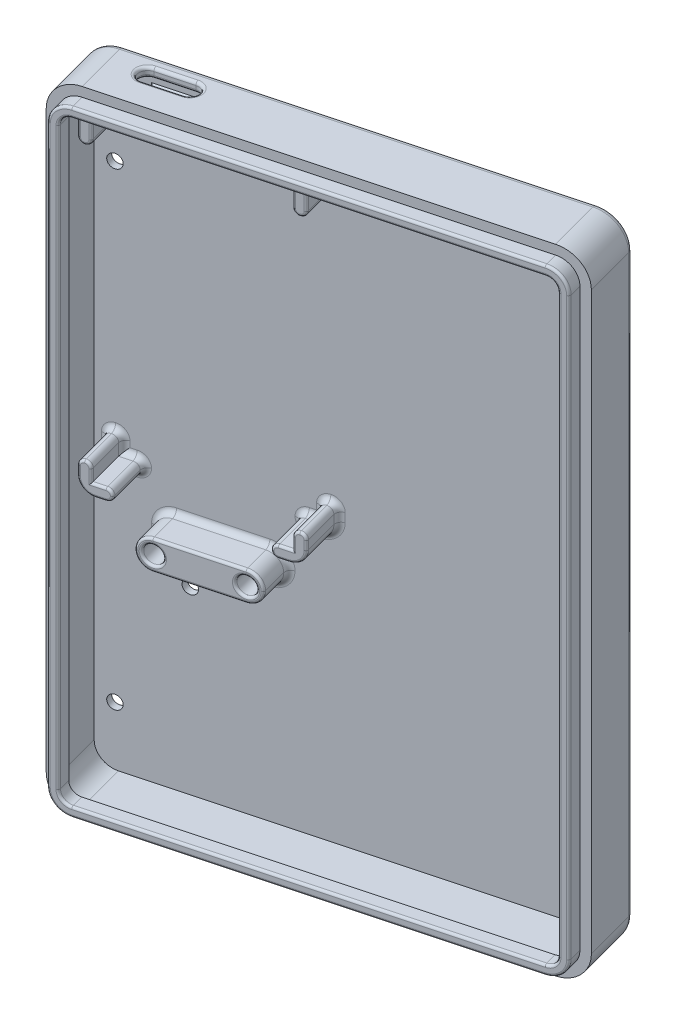
from build123d import *

# Parameters (mm, degrees)
BOSS_EXTRUDE1_DEPTH      = 10
FILLET1_R                = 5
FILLET2_R                = 1
SHELL1_T                 = -1.6
SHELL1_THICKNESS_2_DEPTH = 0.4
SKETCH2_W                = 2
SKETCH2_H                = 5.000000000000007
BOSS_EXTRUDE2_DEPTH      = 7.5
SKETCH2_3_W              = 18.000000000000128
SKETCH2_3_H              = 5
SKETCH2_3_R              = 1.4999999999999967
BOSS_EXTRUDE3_DEPTH      = 5.75
FILLET3_R                = 2.5
FILLET4_R                = 1
FILLET5_R                = 0.4
BOSS_EXTRUDE4_DEPTH      = 1
CUT_EXTRUDE1_DEPTH       = 135.00829340306532
FILLET6_R                = 0.5
BOSS_EXTRUDE5_DEPTH      = 2.5
BOSS_EXTRUDE5_DEPTH_BACK = 1.5
BOSS_EXTRUDE5_START      = 8.8
SHELL2_T                 = -1.6
FILLET8_R                = 0.4
CHAMFER1_SIZE            = 1.6
FILLET9_R                = 0.5
SKETCH6_R                = 1.1500000000000026
SKETCH6_R_2              = 1.149999999999996
SKETCH6_R_3              = 1.1499999999999893
CUT_EXTRUDE2_DEPTH       = 97.07169882733713
BOSS_EXTRUDE6_START      = -5.75
SKETCH7_W                = 20.00000000000005
SKETCH7_H                = 5
BOSS_EXTRUDE6_DEPTH      = 0.75
CHAMFER2_SIZE            = 0.75


# Some blends are built 0.0001 mm under size
with BuildPart() as part:
    # Sketch1 → Boss-Extrude1 (new body)
    with BuildSketch(Plane(origin=(-3.669259578336618, 0, -13.693863172510985), x_dir=(0.9659258262890682, 0, -0.2588190451025213), z_dir=(-0.2588190451025213, 0, -0.9659258262890682))):
        Polygon((-74.20000000000003, 51.599999999999994), (1.799999999999982, 51.599999999999994), (1.799999999999996, -56.6), (-74.20000000000002, -56.6), align=None)
    extrude(amount=BOSS_EXTRUDE1_DEPTH)

    # Fillet1
    fillet1_edges = [part.edges().sort_by_distance(p)[0] for p in [
        (-76.63505111449813, -51.599999999999994, 0.6808808426507635),
        (-3.224688316528919, -51.599999999999994, -18.989366585140857),
        (-3.2246883165289053, 56.6, -18.989366585140864),
        (-76.63505111449811, 56.6, 0.68088084265076),
    ]]
    fillet(fillet1_edges, radius=FILLET1_R)

    # Fillet2
    fillet2_edges = [part.edges().sort_by_distance(p)[0] for p in [
        (-41.22396494102611, -51.599999999999994, -13.983872002690394),
        (-4.518783542041518, 2.500000000000007, -23.818995716586205),
        (-77.92914634001073, 2.499999999999993, -4.148748288794579),
        (-41.22396494102611, 56.6, -13.983872002690394),
        (-76.51458071802648, -50.135533905932746, -4.527780004846088),
        (-76.51458071802648, 55.13553390593274, -4.527780004846088),
        (-5.933349164025755, 55.135533905932746, -23.439964000534697),
        (-5.933349164025763, -50.13553390593273, -23.439964000534694),
    ]]
    fillet(fillet2_edges, radius=FILLET2_R)

    # Shell1
    shell1_openings = [part.faces().sort_by_distance(p)[0] for p in [
        (-38.63577449, 2.5, -4.32461374),
    ]]
    offset(amount=SHELL1_T, openings=shell1_openings, kind=Kind.INTERSECTION)

    # Shell1 thickness 2 face (on inner face of the shell) → Shell1 thickness 2 (cut)
    with BuildSketch(Plane(origin=(-40.809854469, 2.5, -12.438390681), x_dir=(-0.965925826289, 0, 0.258819045103), z_dir=(-0.258819045103, 0, -0.965925826289))):
        with BuildLine():
            Line((32.99999999996312, -52.5), (-33.00000000003692, -52.5))
            ThreePointArc((-33.00000000003692, -52.49999999999999), (-35.404163056071184, -51.50416305603426), (-36.40000000003692, -49.099999999999994))
            Line((-36.400000000036925, -49.099999999999994), (-36.40000000003694, 49.10000000000001))
            ThreePointArc((-36.40000000003693, 49.10000000000001), (-35.40416305607119, 51.50416305603427), (-33.00000000003693, 52.50000000000001))
            Line((-33.000000000036934, 52.50000000000001), (32.99999999996312, 52.50000000000001))
            ThreePointArc((32.999999999963094, 52.5), (35.40416305599737, 51.504163056034265), (36.3999999999631, 49.1))
            Line((36.3999999999631, 49.1), (36.399999999963114, -49.100000000000016))
            ThreePointArc((36.3999999999631, -49.10000000000001), (35.40416305599736, -51.50416305603427), (32.999999999963094, -52.50000000000001))
        make_face()
    extrude(amount=SHELL1_THICKNESS_2_DEPTH, mode=Mode.SUBTRACT)

    # Sketch2 → Boss-Extrude2 (add)
    with BuildSketch(Plane(origin=(-5.946867175238807, 5e-17, -22.19401044385479), x_dir=(0.9659258262890682, 0, -0.2588190451025213), z_dir=(0.2588190451025213, 0, 0.9659258262890682))):
        Polygon((-70.59999999999977, -4.650000000000041), (-70.59999999999977, 0.349999999999958), (-68.59999999999977, 0.349999999999958), (-68.59999999999977, -2.650000000000041), (-65.59999999999977, -2.650000000000041), (-65.59999999999977, -4.650000000000041), align=None)
        Polygon((-40.599999999999746, 0.34999999999995884), (-38.599999999999746, 0.34999999999995884), (-38.599999999999746, -4.650000000000041), (-43.59999999999975, -4.650000000000041), (-43.59999999999975, -2.650000000000041), (-40.599999999999746, -2.650000000000041), align=None)
        with Locations((-69.59999999999977, 49.5)):
            Rectangle(SKETCH2_W, SKETCH2_H)
        with Locations((-39.599999999999746, 49.5)):
            Rectangle(SKETCH2_W, SKETCH2_H)
    extrude(amount=BOSS_EXTRUDE2_DEPTH)

    # Sketch2<3> → Boss-Extrude3 (add)
    with BuildSketch(Plane(origin=(-5.946867175238807, 5e-17, -22.19401044385479), x_dir=(0.9659258262890682, 0, -0.2588190451025213), z_dir=(0.2588190451025213, 0, 0.9659258262890682))):
        with Locations((-54.5999999999997, -11.74999999999998)):
            Rectangle(SKETCH2_3_W, SKETCH2_3_H)
        with Locations((-48.099999999999646, -11.74999999999998)):
            Circle(SKETCH2_3_R, mode=Mode.SUBTRACT)
        with Locations((-61.09999999999977, -11.749999999999979)):
            Circle(SKETCH2_3_R, mode=Mode.SUBTRACT)
    extrude(amount=BOSS_EXTRUDE3_DEPTH)

    # Fillet3
    fillet3_edges = [part.edges().sort_by_distance(p)[0] for p in [
        (-49.24898009935022, -14.24999999999998, -7.614825236598841),
        (-49.24898009935022, -9.24999999999998, -7.614825236598841),
        (-66.63564497255356, -9.24999999999998, -2.9560824247534265),
        (-66.63564497255356, -14.24999999999998, -2.9560824247534265),
        (-73.17065909211234, -4.650000000000041, -0.29916401103284196),
        (-42.261032650862134, -4.650000000000041, -8.581373454313528),
    ]]
    fillet(fillet3_edges, radius=FILLET3_R - 0.0001)  # a hair under: the kernel refuses the full size

    # Fillet4
    fillet4_edges = [part.edges().sort_by_distance(p)[0] for p in [
        (-44.19288430344027, 0.3499999999999589, -8.063735364108485),
        (-46.61234446200834, -2.650000000000041, -11.297728645038708),
        (-48.061233201441944, -3.650000000000041, -10.909500077384925),
        (-47.090661782307485, -2.650000000000041, -7.287278228800918),
        (-47.090661782307485, -4.650000000000041, -7.287278228800918),
        (-44.197529896285666, 0.3499999999999589, -11.944776257795013),
        (-73.17530468495772, 52.00000000000001, -4.180204904719368),
        (-71.2388074395342, 52.00000000000001, -0.8168021012378848),
        (-73.17065909211234, 52.00000000000001, -0.2991640110328415),
        (-73.17065909211234, 47.00000000000001, -0.2991640110328415),
        (-72.20937885866866, 49.50000000000001, -4.439023949821891),
        (-71.2388074395342, 47.00000000000001, -0.8168021012378848),
        (-73.17530468495772, 47.00000000000001, -4.180204904719368),
        (-74.1412305112468, 49.50000000000001, -3.921385859616848),
        (-44.197529896285666, 47.00000000000001, -11.944776257795013),
        (-44.19288430344027, 47.00000000000001, -8.063735364108485),
        (-42.261032650862134, 47.00000000000001, -8.581373454313528),
        (-42.261032650862134, 52.00000000000001, -8.581373454313528),
        (-45.16345572257473, 49.50000000000001, -11.685957212692491),
        (-44.19288430344027, 52.00000000000001, -8.063735364108485),
        (-44.197529896285666, 52.00000000000001, -11.944776257795013),
        (-43.23160406999659, 49.50000000000001, -12.203595302897535),
        (-73.17065909211234, 0.349999999999958, -0.2991640110328415),
        (-68.341029960667, -4.650000000000041, -1.5932592365454479),
        (-68.341029960667, -2.650000000000041, -1.5932592365454479),
        (-73.17530468495772, 0.349999999999958, -4.180204904719368),
        (-71.2388074395342, 0.349999999999958, -0.8168021012378848),
        (-72.20937885866866, -1.1500000000000417, -4.439023949821891),
        (-70.76049011923506, -2.650000000000041, -4.827252517475671),
        (-69.31160137980146, -3.650000000000041, -5.215481085129454),
        (-70.51905695895411, -4.650000000000041, -4.891944337799046),
        (-74.1412305112468, -0.900050000000042, -3.921385859616848),
        (-43.23160406999659, -0.9000500000000415, -12.203595302897535),
        (-46.85377762228929, -4.650000000000041, -11.233036824715333),
        (-58.68641729062165, -14.24999999999998, -8.062490581257203),
        (-58.686417290621634, -9.24999999999998, -8.062490581257208),
        (-73.43397599166543, -3.9177962422882926, -4.110894137375142),
        (-43.93885858977793, -3.917796242288289, -12.014087025885495),
        (-50.700339373800446, -13.517796242288233, -10.202353710164621),
        (-50.70033937380044, -9.982203757711732, -10.202353710164623),
        (-66.6724952076428, -9.982203757711723, -5.92262745309605),
        (-66.67249520764283, -13.517796242288231, -5.9226274530960445),
        (-42.261032650862134, 0.3499999999999589, -8.581373454313528),
        (-45.16345572257473, -1.1500000000000412, -11.685957212692491),
    ]]
    fillet(fillet4_edges, radius=FILLET4_R - 0.0001)  # a hair under: the kernel refuses the full size

    # Fillet5
    fillet5_edges = [part.edges().sort_by_distance(p)[0] for p in [
        (-44.188287006886206, -2.650000000000041, -4.182681529469702),
        (-69.30226189781938, -2.650000000000041, 2.546587761291349),
        (-64.92561439159476, -11.749999999999979, -0.43786471927487725),
        (-52.36857864983675, -11.74999999999998, -3.802512305607685),
        (-69.06082873753843, -4.650000000000041, 2.481895940967977),
        (-72.20008767297789, -1.4000000000000417, 3.323057837551165),
        (-71.49283315329822, -3.9177962422882926, 3.1335495601597363),
        (-41.29046123172768, -1.4000000000000414, -4.959151605729522),
        (-44.42972016716716, -4.650000000000041, -4.117989709146325),
        (-41.99771575140737, -3.917796242288295, -4.769643328338092),
        (-57.19820778128215, -14.24999999999998, -2.5084170800950627),
        (-57.19820778128214, -9.24999999999998, -2.5084170800950663),
        (-65.18428569820415, -13.517796242288233, -0.36855395156378584),
        (-65.18428569820414, -9.982203757711728, -0.36855395156378945),
        (-49.21212986436016, -9.982203757711728, -4.648280208626337),
        (-49.21212986436016, -13.517796242288233, -4.648280208626337),
        (-43.22231288430582, -1.6499500000000409, -4.441513515524479),
        (-70.26823602039974, -1.6499500000000413, 2.8054197473461215),
        (-43.22231288430582, 49.50000000000001, -4.441513515524479),
        (-72.20008767297789, 49.50000000000001, 3.323057837551165),
        (-41.29046123172768, 49.50000000000001, -4.959151605729522),
        (-70.26823602039974, 49.50000000000001, 2.8054197473461215),
        (-70.55112085348415, 47.292863929491574, 2.8812185099221073),
        (-71.91720283989346, 47.29286392949157, 3.247259074975185),
        (-71.91720283989348, 51.70713607050844, 3.2472590749751866),
        (-70.55112085348415, 51.70713607050844, 2.8812185099221077),
        (-42.93942805122141, 47.292863929491574, -4.517312278100461),
        (-41.57334606481209, 47.292863929491574, -4.883352843153545),
        (-41.57334606481209, 51.70713607050844, -4.883352843153545),
        (-42.93942805122142, 51.70713607050844, -4.5173122781004595),
        (-45.837205530088625, -2.9428639294916126, -3.7408551427928947),
        (-45.83720553008863, -4.357136070508471, -3.740855142792893),
        (-42.93942805122141, 0.05713607050838776, -4.517312278100461),
        (-41.57334606481209, 0.05713607050838798, -4.883352843153545),
        (-71.91720283989346, 0.05713607050839242, 3.2472590749751835),
        (-70.55112085348415, 0.05713607050838632, 2.881218509922107),
        (-67.65334337461695, -2.942863929491612, 2.1047613746145437),
        (-67.65334337461695, -4.35713607050847, 2.1047613746145437),
    ]]
    fillet(fillet5_edges, radius=FILLET5_R)

    # Sketch4 → Boss-Extrude4 (add)
    with BuildSketch(Plane.XZ.offset(-55.00000000000001)):
        Polygon((-59.095384256799875, 0.07048218523944016), (-59.61302234700492, -1.8613694673386962), (-57.19820778128223, -2.5084170800950076), (-56.68056969107718, -0.5765654275168688), align=None)
        Polygon((-56.68056969107718, -0.5765654275168688), (-57.19820778128223, -2.508417080095012), (-54.78339321555958, -3.155464692851307), (-54.26575512535453, -1.2236130402731697), align=None)
    extrude(amount=BOSS_EXTRUDE4_DEPTH)

    # Sketch4<3> → Cut-Extrude1 (cut, through all)
    with BuildSketch(Plane.XZ.offset(-55.00000000000001)):
        with BuildLine():
            Line((-61.43144174156449, -6.1363958889517844), (-67.08210782535566, -4.622304475102))
            ThreePointArc((-67.08210782535566, -4.622304475102), (-68.14276799713546, -2.7851871680144895), (-66.3056506900479, -1.724526996234793))
            Line((-66.3056506900479, -1.724526996234793), (-60.654984606256846, -3.2386184100845483))
            ThreePointArc((-60.654984606256846, -3.2386184100845483), (-59.59432443447708, -5.075735717171979), (-61.43144174156449, -6.1363958889517844))
        make_face()
    extrude(amount=-CUT_EXTRUDE1_DEPTH, mode=Mode.SUBTRACT)

    # Fillet6
    fillet6_edges = [part.edges().sort_by_distance(p)[0] for p in [
        (-64.25677478346007, 55.00000000000001, -5.379350182026892),
        (-68.14276799713546, 56.6, -2.785187168014492),
        (-63.48031764815237, 55.00000000000001, -2.481572703159671),
        (-59.59432443447708, 56.6, -5.075735717171982),
        (-64.25677478346007, 56.6, -5.37935018202689),
        (-63.48031764815238, 56.6, -2.481572703159671),
        (-59.59432443447708, 55.00000000000001, -5.075735717171982),
        (-68.14276799713546, 55.00000000000001, -2.7851871680144926),
    ]]
    fillet(fillet6_edges, radius=FILLET6_R)


with BuildPart() as body_2:
    # Sketch5 → Boss-Extrude5 (new, two sides: drawn at the far end of the back side and taken through both)
    with BuildSketch(Plane(origin=(-5.946867175238807, 5e-17, -22.19401044385479), x_dir=(0.9659258262890682, 0, -0.2588190451025213), z_dir=(0.2588190451025213, 0, 0.9659258262890682)).offset(BOSS_EXTRUDE5_START - BOSS_EXTRUDE5_DEPTH_BACK)):
        with BuildLine():
            Line((-69.20000000000005, -49.99999999999999), (-3.2000000000000077, -49.99999999999999))
            ThreePointArc((-3.2000000000000077, -49.99999999999999), (-0.7958369439657518, -49.00416305603425), (0.1999999999999836, -46.599999999999994))
            Line((0.1999999999999836, -46.599999999999994), (0.19999999999999532, 51.600000000000065))
            ThreePointArc((0.19999999999999532, 51.600000000000065), (-0.7958369439657655, 54.00416305603428), (-3.1999999999999926, 55.00000000000001))
            Line((-3.1999999999999926, 55.00000000000001), (-69.20000000000003, 55.00000000000001))
            ThreePointArc((-69.20000000000003, 55.00000000000001), (-71.60416305603428, 54.004163056034294), (-72.60000000000004, 51.600000000000065))
            Line((-72.60000000000004, 51.600000000000065), (-72.60000000000005, -46.600000000000016))
            ThreePointArc((-72.60000000000005, -46.600000000000016), (-71.60416305603431, -49.004163056034265), (-69.20000000000005, -49.99999999999999))
        make_face()
    extrude(amount=BOSS_EXTRUDE5_DEPTH + BOSS_EXTRUDE5_DEPTH_BACK)

    # Shell2
    shell2_openings = [body_2.faces().sort_by_distance(p)[0] for p in [
        (-39.024003058, 2.5, -5.773502479),
        (-37.988726877, 2.5, -1.909799174),
    ]]
    offset(amount=SHELL2_T, openings=shell2_openings, kind=Kind.INTERSECTION)


with BuildPart() as part_1:
    add(part.part)

    # Combine1: union body 2
    add(body_2.part)

    # Fillet8
    fillet8_edges = [part_1.edges().sort_by_distance(p)[0] for p in [
        (-72.18652233121739, 54.004163056034294, 7.253472500739708),
        (-3.790931423271815, 54.00416305603428, -11.07307084889379),
        (-3.790931423271802, -49.00416305603425, -11.073070848893794),
        (-72.18652233121742, -49.00416305603427, 7.253472500739715),
        (-4.883751746299359, 52.87279220613579, -10.780250525866244),
        (-4.883751746299354, -47.87279220613578, -10.780250525866242),
        (-71.0937020081899, -47.87279220613579, 6.96065217771216),
        (-71.09370200818988, 52.87279220613581, 6.960652177712156),
        (-37.9887268772446, 55.00000000000001, -1.909799174077044),
        (-73.1484269541667, 2.5000000000000284, 7.511214067654738),
        (-37.98872687724461, -49.99999999999999, -1.9097991740770421),
        (-2.8290268003225125, 2.5000000000000355, -11.33081241580882),
        (-4.374508122385019, 2.5000000000000355, -10.916701943644787),
        (-37.98872687724461, -48.4, -1.909799174077044),
        (-71.60294563210421, 2.500000000000025, 7.097103595490706),
        (-37.9887268772446, 53.40000000000001, -1.9097991740770448),
    ]]
    fillet(fillet8_edges, radius=FILLET8_R)

    # Chamfer1
    # the kernel refuses this chamfer: 1.6 mm, written as the material it takes off along each edge
    with BuildSketch(Plane(origin=(-70.89955532519399, -46.60000000000001, 2.767526009149896), x_dir=(0, -1, -9.9e-16), z_dir=(0.9659258262890682, 0, -0.2588190451025213))) as chamfer1_piece_1:
        Polygon((1.7999999999999885, -CHAMFER1_SIZE), (1.79999999999999 + CHAMFER1_SIZE, -8.63e-15), (1.79999999999999, 8.6e-16), align=None)
    revolve(axis=Axis((-70.89955532519399, -46.60000000000001, 2.767526009149896), (-0.2588190451025213, 0, -0.9659258262890682)), revolution_arc=90.0000000000001, mode=Mode.SUBTRACT)
    with BuildSketch(Plane(origin=(-72.6382218125143, -46.60000000000001, 3.233400290334434), x_dir=(0.2588190451025332, 0, 0.965925826289065), z_dir=(1.4e-16, 1, -4e-17))) as chamfer1_piece_2:
        Polygon((CHAMFER1_SIZE, 0), (-2.228e-14, -CHAMFER1_SIZE), (0, 0), align=None)
    extrude(amount=98.20000000000007, mode=Mode.SUBTRACT)
    with BuildSketch(Plane(origin=(-70.89955532519399, 51.60000000000003, 2.767526009149896), x_dir=(-0.9659258262890682, 1.1842378929335146e-14, 0.2588190451025209), z_dir=(-1.144e-14, -1, 3.06e-15))) as chamfer1_piece_3:
        Polygon((1.79999999999997, -CHAMFER1_SIZE), (1.7999999999999783 + CHAMFER1_SIZE, -4.08e-15), (1.7999999999999783, -4.6e-16), align=None)
    revolve(axis=Axis((-70.89955532519399, 51.60000000000003, 2.767526009149896), (-0.2588190451025213, 0, -0.9659258262890682)), revolution_arc=89.9999999999999, mode=Mode.SUBTRACT)
    with BuildSketch(Plane(origin=(-70.89955532519397, 53.40000000000001, 2.7675260091498926), x_dir=(0.25881904510252124, -4.440892098500635e-15, 0.9659258262890681), z_dir=(0.9659258262890682, 0, -0.2588190451025213))) as chamfer1_piece_4_section:
        Polygon((CHAMFER1_SIZE, 0), (-6.25e-15, -CHAMFER1_SIZE), (0, 0), align=None)
    chamfer1_piece_4 = extrude(amount=66.00000000000006, mode=Mode.PRIVATE)
    chamfer1_piece_4 = split(chamfer1_piece_4, bisect_by=Plane(origin=(-70.89955532519397, 54.00000000000001, 2.7675260091498926), z_dir=(0, -1, 0)), keep=Keep.TOP, mode=Mode.PRIVATE)
    add(chamfer1_piece_4, mode=Mode.SUBTRACT)
    with BuildSketch(Plane(origin=(-70.89955532519397, 53.40000000000001, 2.7675260091498926), x_dir=(0.25881904510252124, -4.440892098500635e-15, 0.9659258262890681), z_dir=(0.9659258262890682, 0, -0.2588190451025213))) as chamfer1_piece_5_section:
        Polygon((CHAMFER1_SIZE, 0), (-6.25e-15, -CHAMFER1_SIZE), (0, 0), align=None)
    chamfer1_piece_5 = extrude(amount=66.00000000000006, mode=Mode.PRIVATE)
    chamfer1_piece_5 = split(chamfer1_piece_5, bisect_by=Plane(origin=(-59.211852827096024, 53.40000000000001, -0.3641844365907012), z_dir=(-0.9659258262890676, 0, 0.2588190451025233)), keep=Keep.TOP, mode=Mode.PRIVATE)
    add(chamfer1_piece_5, mode=Mode.SUBTRACT)
    with BuildSketch(Plane(origin=(-70.89955532519397, 53.40000000000001, 2.7675260091498926), x_dir=(0.25881904510252124, -4.440892098500635e-15, 0.9659258262890681), z_dir=(0.9659258262890682, 0, -0.2588190451025213))) as chamfer1_piece_6_section:
        Polygon((CHAMFER1_SIZE, 0), (-6.25e-15, -CHAMFER1_SIZE), (0, 0), align=None)
    chamfer1_piece_6 = extrude(amount=66.00000000000006, mode=Mode.PRIVATE)
    chamfer1_piece_6 = split(chamfer1_piece_6, bisect_by=Plane(origin=(-54.38222369565068, 53.40000000000001, -1.6582796621033156), z_dir=(0.9659258262890676, 0, -0.2588190451025232)), keep=Keep.TOP, mode=Mode.PRIVATE)
    add(chamfer1_piece_6, mode=Mode.SUBTRACT)
    with BuildSketch(Plane(origin=(-7.148450790115446, 51.59999999999998, -14.314530967616518), x_dir=(9.87e-15, 1, -2.96e-15), z_dir=(-0.9659258262890682, 1.02986413453465e-14, 0.2588190451025213))) as chamfer1_piece_7:
        Polygon((1.800000000000025, -CHAMFER1_SIZE), (1.8000000000000256 + CHAMFER1_SIZE, -2.11e-15), (1.8000000000000256, -2.3e-16), align=None)
    revolve(axis=Axis((-7.148450790115446, 51.59999999999998, -14.314530967616518), (-0.2588190451025213, 0, -0.9659258262890682)), revolution_arc=89.99999999999797, mode=Mode.SUBTRACT)
    with BuildSketch(Plane(origin=(-5.409784302795096, 51.600000000000065, -14.780405248801062), x_dir=(0.25881904510251824, 0, 0.965925826289069), z_dir=(-1.2e-16, -1, 3e-17))) as chamfer1_piece_8:
        Polygon((CHAMFER1_SIZE, 1e-17), (-6.55e-15, -CHAMFER1_SIZE), (0, 0), align=None)
    extrude(amount=98.20000000000006, mode=Mode.SUBTRACT)
    with BuildSketch(Plane(origin=(-7.148450790115434, -46.599999999999994, -14.31453096761652), x_dir=(0.9659258262890681, 0, -0.2588190451025214), z_dir=(0, 1, 0))) as chamfer1_piece_9:
        Polygon((1.7999999999999996, -CHAMFER1_SIZE), (1.7999999999999983 + CHAMFER1_SIZE, 7.9e-16), (1.7999999999999983, -1.67e-15), align=None)
    revolve(axis=Axis((-7.148450790115434, -46.599999999999994, -14.31453096761652), (-0.2588190451025213, 0, -0.9659258262890682)), revolution_arc=89.9999999999999, mode=Mode.SUBTRACT)
    with BuildSketch(Plane(origin=(-7.148450790115419, -48.4, -14.314530967616525), x_dir=(0.2588190451025213, 4.440892098500637e-15, 0.9659258262890681), z_dir=(-0.9659258262890682, 0, 0.2588190451025213))) as chamfer1_piece_10:
        Polygon((CHAMFER1_SIZE, 0), (-5.39e-15, -CHAMFER1_SIZE), (0, 0), align=None)
    extrude(amount=66.00000000000006, mode=Mode.SUBTRACT)

    # Fillet9
    fillet9_edges = [part_1.edges().sort_by_distance(p)[0] for p in [
        (-57.19820778128225, 55.00000000000001, -2.5084170800950014),
        (-59.61302234700492, 54.50000000000001, -1.8613694673386962),
        (-54.582808455605125, 55.00000000000001, -2.4068721774772928),
        (-54.78339321555958, 54.50000000000001, -3.155464692851307),
        (-59.28302806449967, 54.00000000000001, -0.6298140388229869),
        (-57.19820778128225, 54.00000000000001, -2.5084170800950014),
        (-54.45339893305487, 54.00000000000001, -1.9239092643366922),
        (-59.41243758705047, 55.00000000000001, -1.1127769519646846),
    ]]
    fillet(fillet9_edges, radius=FILLET9_R - 0.0001)  # a hair under: the kernel refuses the full size

    # Sketch6 → Cut-Extrude2 (cut, through all)
    with BuildSketch(Plane(origin=(-5.946867175238807, 5e-17, -22.19401044385479), x_dir=(0.9659258262890682, 0, -0.2588190451025213), z_dir=(0.2588190451025213, 0, 0.9659258262890682))):
        with Locations((-69.70000000000002, 40)):
            Circle(SKETCH6_R)
        with Locations((-59.20000000000003, -19.249999999999982)):
            Circle(SKETCH6_R_2)
        with Locations((-69.70000000000002, -40.00000000000001)):
            Circle(SKETCH6_R_3)
    extrude(amount=-CUT_EXTRUDE2_DEPTH, mode=Mode.SUBTRACT)

    # Sketch7 → Boss-Extrude6 (add)
    with BuildSketch(Plane(origin=(-4.458657665899306, 3e-16, -16.639936942692632), x_dir=(0.9659258262890682, 0, -0.2588190451025213), z_dir=(0.2588190451025213, 0, 0.9659258262890682)).offset(BOSS_EXTRUDE6_START)):
        with Locations((-54.59999999999977, 50.90000000000001)):
            Rectangle(SKETCH7_W, SKETCH7_H)
    extrude(amount=BOSS_EXTRUDE6_DEPTH)

    # Chamfer2
    chamfer2_edges = [part_1.edges().sort_by_distance(p)[0] for p in [
        (-48.83304474390411, 50.90000000000001, -9.926236662565588),
        (-58.49230300679481, 53.40000000000001, -7.338046211540368),
        (-58.49230300679481, 48.40000000000001, -7.3380462115403695),
        (-68.15156126968552, 50.90000000000001, -4.74985576051515),
    ]]
    chamfer(chamfer2_edges, length=CHAMFER2_SIZE - 0.0001)  # a hair under: the kernel refuses the full size


solid = part_1.part
